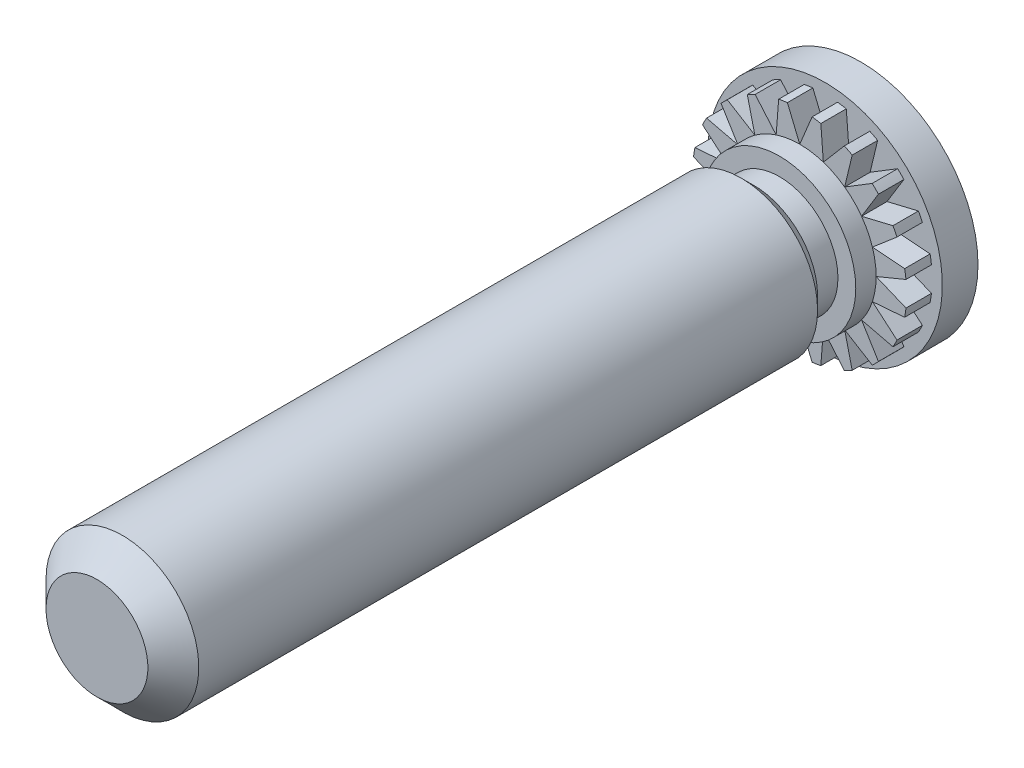
from build123d import *

# Parameters (mm, degrees)
SKETCH_1_R               = 2.3
EXTRUDE_1_DEPTH          = 1.2
SKETCH_2_R               = 1.4999999999999996
EXTRUDE_2_DEPTH          = 1.5
CUT_EXTRUDE_1_DEPTH      = 0.5
PATTERN_CIRCULAR_1_COUNT = 20
SKETCH_4_W               = 0.3500000000000001
SKETCH_4_H               = 0.49999999999999956
SKETCH_6_W               = 12.300000000000002
SKETCH_6_H               = 1.5
CHAMFER_2_SIZE           = 0.5
CUT_EXTRUDE_START        = -0.5
SKETCH_7_R               = 2.3
SKETCH_7_R_2             = 2.1
CUT_EXTRUDE_2_DEPTH      = 0.5


with BuildPart() as part:
    # Эскиз1 → Вытянуть1 (new body)
    with BuildSketch(Plane.XY):
        Circle(SKETCH_1_R)
    extrude(amount=EXTRUDE_1_DEPTH)

    # Эскиз2 → Вытянуть2 (add)
    with BuildSketch(Plane.XY.offset(1.2)):
        Circle(SKETCH_2_R)
    extrude(amount=EXTRUDE_2_DEPTH)

    # Эскиз3 → Вырез-Вытянуть1 (cut)
    with BuildSketch(Plane.XY.offset(1.2)):
        Polygon((-0.33137084989847343, 2.3), (0.33137084989847343, 2.3), (0, 1.4999999999999996), align=None)
    cut_extrude_1 = extrude(amount=-CUT_EXTRUDE_1_DEPTH, mode=Mode.SUBTRACT)

    # Круговой массив1: Вырез-Вытянуть1 ×20 about axis
    pattern_circular_1_axis = Axis((0, -4e-17, 0), (0, 0, 1))
    for i in range(1, PATTERN_CIRCULAR_1_COUNT):
        add(cut_extrude_1.rotate(pattern_circular_1_axis, i * 360 / PATTERN_CIRCULAR_1_COUNT), mode=Mode.SUBTRACT)

    # Эскиз4 → Вырез-Повернуть1 (revolve, cut)
    with BuildSketch(Plane(origin=(0, 0, 0), x_dir=(1, 0, 0), z_dir=(0, 1, 0))):
        with Locations((1.325, -1.8500000000000003)):
            Rectangle(SKETCH_4_W, SKETCH_4_H)
    revolve(axis=Axis((0, 0, 10.642619982654564), (0, 0, -1)), mode=Mode.SUBTRACT)

    # Эскиз6 → Повернуть1 (revolve)
    with BuildSketch(Plane(origin=(0, 0, 0), x_dir=(0, 0, -1), z_dir=(1, 0, 0)), mode=Mode.PRIVATE) as revolve_1_sk:
        with Locations((-8.850000000000001, -0.75)):
            Rectangle(SKETCH_6_W, SKETCH_6_H)
    revolve(revolve_1_sk.sketch.rotate(Axis((0, 0, 2.6999999999999997), (0, 0, 1)), 278.047567557), axis=Axis((0, 0, 2.6999999999999997), (0, 0, 1)))

    # Фаска2
    # the kernel refuses this chamfer: 0.5 mm, written as the material it takes off along each edge
    with BuildSketch(Plane(origin=(0, 0, 15.000000000000002), x_dir=(-0.9901521845161062, -0.1399951838385265, 0), z_dir=(-0.1399951838385265, 0.9901521845161062, 0))) as chamfer_2_piece_1:
        Polygon((1.4999999999999996, -CHAMFER_2_SIZE), (1.5000000000000004 - CHAMFER_2_SIZE, -1.78e-15), (1.5000000000000004, 0), align=None)
    revolve(axis=Axis((0, 0, 15.000000000000002), (0, 0, 1)), mode=Mode.SUBTRACT)

    # Эскиз7 → Вырез-Вытянуть2 (cut)
    with BuildSketch(Plane.XY.offset(1.2).offset(CUT_EXTRUDE_START)):
        with Locations(Location((0, 0, 0), (0, 0, 180))):
            Circle(SKETCH_7_R)
        Circle(SKETCH_7_R_2, mode=Mode.SUBTRACT)
    extrude(amount=CUT_EXTRUDE_2_DEPTH, mode=Mode.SUBTRACT)

    # Фаска3
    # the kernel refuses this chamfer: 0.25 mm, written as the material it takes off along each edge
    with BuildSketch(Plane(origin=(0, 0, 2.0999999999999996), x_dir=(1, 0, 0), z_dir=(0, 1, 0))) as chamfer_3_piece_1:
        with BuildLine():
            Line((1.2429289321881345, 0.00707106781186528), (1.507071067811865, -0.2570710678118653))
            Line((1.507071067811865, -0.2570710678118653), (1.512071067811865, -0.2570710678118653))
            ThreePointArc((1.512071067811865, -0.2570710678118653), (1.5049999999999994, -0.12853553390593264), (1.505, 0))
            Line((1.505, 0), (1.5, 0.00499999999999989))
            ThreePointArc((1.5, 0.00499999999999989), (1.3714644660940674, 0.00499999999999989), (1.2429289321881345, 0.01207106781186518))
            Line((1.2429289321881345, 0.01207106781186518), (1.2429289321881345, 0.00707106781186528))
        make_face()
    revolve(axis=Axis((0, 0, 2.0999999999999996), (0, 0, -1)), mode=Mode.SUBTRACT)


solid = part.part
